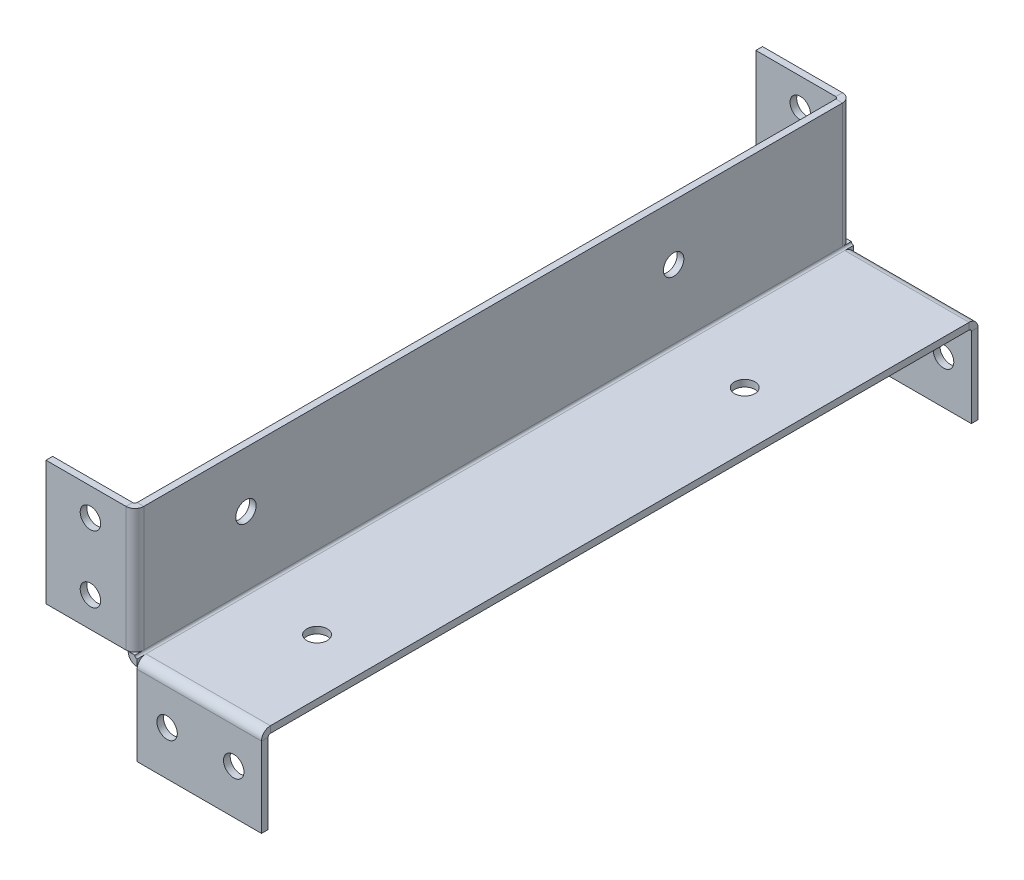
from build123d import *

# Parameters (mm, degrees)
SKETCH1_W                      = 60
SKETCH1_H                      = 322.5
BASE_FLANGE1_DEPTH             = 3
EDGE_FLANGE1_STRIP_W           = 14
EDGE_FLANGE1_STRIP_H           = 3
EDGE_FLANGE1_STRIP_CUT_DEPTH   = 322.5
EDGE_FLANGE1_DEPTH             = 322.5
EDGE_FLANGE2_STRIP_W           = 14
EDGE_FLANGE2_STRIP_H           = 3
EDGE_FLANGE2_STRIP_CUT_DEPTH   = 56
EDGE_FLANGE2_STRIP_2_W         = 14
EDGE_FLANGE2_STRIP_2_H         = 3
EDGE_FLANGE2_STRIP_CUT_2_DEPTH = 56
EDGE_FLANGE2_STRIP_3_W         = 14
EDGE_FLANGE2_STRIP_3_H         = 3
EDGE_FLANGE2_STRIP_CUT_3_DEPTH = 56
EDGE_FLANGE2_STRIP_4_W         = 14
EDGE_FLANGE2_STRIP_4_H         = 3
EDGE_FLANGE2_STRIP_CUT_4_DEPTH = 56
EDGE_FLANGE2_DEPTH             = 56
EDGE_FLANGE2_BEND_DEPTH        = 56
EDGE_FLANGE2_BEND_2_DEPTH      = 56
EDGE_FLANGE2_BEND_3_DEPTH      = 56
SKETCH18_R                     = 4.6
EXTRUDE1_DEPTH                 = 335.806287277
SKETCH19_R                     = 4.6
EXTRUDE2_DEPTH                 = 3
SKETCH20_R                     = 4.6
EXTRUDE3_DEPTH                 = 3


# Sheet-metal steps are written as plain solids
with BuildPart() as part:
    # Sketch1 → Base-Flange1 (new body)
    with BuildSketch(Plane(origin=(0, 0, 0), x_dir=(1, 0, 0), z_dir=(0, 1, 0))):
        Rectangle(SKETCH1_W, SKETCH1_H)
    extrude(amount=BASE_FLANGE1_DEPTH)

    # Edge-Flange1 strip (across the edge) → Edge-Flange1 strip cut (cut)
    with BuildSketch(Plane(origin=(-30, 3, -161.25), x_dir=(1, 0, 0), z_dir=(0, 0, 1))):
        with Locations((-3, -1.5)):
            Rectangle(EDGE_FLANGE1_STRIP_W, EDGE_FLANGE1_STRIP_H)
    extrude(amount=EDGE_FLANGE1_STRIP_CUT_DEPTH, mode=Mode.SUBTRACT)

    # Edge-Flange1 section (across the edge) → Edge-Flange1 (add)
    with BuildSketch(Plane(origin=(-30, 3, -161.25), x_dir=(1, 0, 0), z_dir=(0, 0, 1))):
        with BuildLine():
            Line((0, 1), (0, 57))
            Line((0, 57), (3, 57))
            Line((3, 57), (3, 1))
            ThreePointArc((3, 1), (3.292893219, 0.292893219), (4, 0))
            Line((4, 0), (4, -3))
            ThreePointArc((4, -3), (1.171572875, -1.828427125), (0, 1))
        make_face()
    extrude(amount=EDGE_FLANGE1_DEPTH)

    # Edge-Flange2 strip (across the edge) → Edge-Flange2 strip cut (cut)
    with BuildSketch(Plane(origin=(-30, 4, 161.25), x_dir=(0, 0, -1), z_dir=(0, 1, 0))):
        with Locations((-3, -1.5)):
            Rectangle(EDGE_FLANGE2_STRIP_W, EDGE_FLANGE2_STRIP_H)
    extrude(amount=EDGE_FLANGE2_STRIP_CUT_DEPTH, mode=Mode.SUBTRACT)

    # Edge-Flange2 strip 2 (across the edge) → Edge-Flange2 strip cut 2 (cut)
    with BuildSketch(Plane(origin=(30, 0, 161.25), x_dir=(0, 0, -1), z_dir=(-1, 0, 0))):
        with Locations((-3, -1.5)):
            Rectangle(EDGE_FLANGE2_STRIP_2_W, EDGE_FLANGE2_STRIP_2_H)
    extrude(amount=EDGE_FLANGE2_STRIP_CUT_2_DEPTH, mode=Mode.SUBTRACT)

    # Edge-Flange2 strip 3 (across the edge) → Edge-Flange2 strip cut 3 (cut)
    with BuildSketch(Plane(origin=(-30, 60, -161.25), x_dir=(0, 0, 1), z_dir=(0, -1, 0))):
        with Locations((-3, -1.5)):
            Rectangle(EDGE_FLANGE2_STRIP_3_W, EDGE_FLANGE2_STRIP_3_H)
    extrude(amount=EDGE_FLANGE2_STRIP_CUT_3_DEPTH, mode=Mode.SUBTRACT)

    # Edge-Flange2 strip 4 (across the edge) → Edge-Flange2 strip cut 4 (cut)
    with BuildSketch(Plane(origin=(-26, 0, -161.25), x_dir=(0, 0, 1), z_dir=(1, 0, 0))):
        with Locations((-3, -1.5)):
            Rectangle(EDGE_FLANGE2_STRIP_4_W, EDGE_FLANGE2_STRIP_4_H)
    extrude(amount=EDGE_FLANGE2_STRIP_CUT_4_DEPTH, mode=Mode.SUBTRACT)

    # Edge-Flange2 section (across the edge) → Edge-Flange2 (add)
    with BuildSketch(Plane(origin=(-30, 4, 161.25), x_dir=(0, 0, -1), z_dir=(0, 1, 0))):
        with BuildLine():
            Line((0, 1), (0, 37))
            Line((0, 37), (3, 37))
            Line((3, 37), (3, 1))
            ThreePointArc((3, 1), (3.292893219, 0.292893219), (4, 0))
            Line((4, 0), (4, -3))
            ThreePointArc((4, -3), (1.171572875, -1.828427125), (0, 1))
        make_face()
    extrude(amount=EDGE_FLANGE2_DEPTH)

    # Edge-Flange2 section 2 (across the edge) → Edge-Flange2 bend (add)
    with BuildSketch(Plane(origin=(30, 0, 161.25), x_dir=(0, 0, -1), z_dir=(-1, 0, 0))):
        with BuildLine():
            Line((0, 1), (0, 37))
            Line((0, 37), (3, 37))
            Line((3, 37), (3, 1))
            ThreePointArc((3, 1), (3.292893219, 0.292893219), (4, 0))
            Line((4, 0), (4, -3))
            ThreePointArc((4, -3), (1.171572875, -1.828427125), (0, 1))
        make_face()
    extrude(amount=EDGE_FLANGE2_BEND_DEPTH)

    # Edge-Flange2 section 3 (across the edge) → Edge-Flange2 bend 2 (add)
    with BuildSketch(Plane(origin=(-30, 60, -161.25), x_dir=(0, 0, 1), z_dir=(0, -1, 0))):
        with BuildLine():
            Line((0, 1), (0, 37))
            Line((0, 37), (3, 37))
            Line((3, 37), (3, 1))
            ThreePointArc((3, 1), (3.292893219, 0.292893219), (4, 0))
            Line((4, 0), (4, -3))
            ThreePointArc((4, -3), (1.171572875, -1.828427125), (0, 1))
        make_face()
    extrude(amount=EDGE_FLANGE2_BEND_2_DEPTH)

    # Edge-Flange2 section 4 (across the edge) → Edge-Flange2 bend 3 (add)
    with BuildSketch(Plane(origin=(-26, 0, -161.25), x_dir=(0, 0, 1), z_dir=(1, 0, 0))):
        with BuildLine():
            Line((0, 1), (0, 37))
            Line((0, 37), (3, 37))
            Line((3, 37), (3, 1))
            ThreePointArc((3, 1), (3.292893219, 0.292893219), (4, 0))
            Line((4, 0), (4, -3))
            ThreePointArc((4, -3), (1.171572875, -1.828427125), (0, 1))
        make_face()
    extrude(amount=EDGE_FLANGE2_BEND_3_DEPTH)

    # Sketch18 → Extrude1 (cut, through all)
    with BuildSketch(Plane.XY.offset(161.25)):
        with Locations((-47, 47.5)):
            Circle(SKETCH18_R)
        with Locations((-47, 17.5)):
            Circle(SKETCH18_R)
        with Locations((-12.5, -17)):
            Circle(SKETCH18_R)
        with Locations((17.5, -17)):
            Circle(SKETCH18_R)
    extrude(amount=-EXTRUDE1_DEPTH, mode=Mode.SUBTRACT)

    # Sketch19 → Extrude2 (cut)
    with BuildSketch(Plane(origin=(-27, 0, 0), x_dir=(0, 0, -1), z_dir=(1, 0, 0))):
        with Locations(Location((-111.25, 35, 0), (0, 0, 90))):
            Circle(SKETCH19_R)
        with Locations(Location((81.25, 35, 0), (0, 0, 90))):
            Circle(SKETCH19_R)
    extrude(amount=-EXTRUDE2_DEPTH, mode=Mode.SUBTRACT)

    # Sketch20 → Extrude3 (cut)
    with BuildSketch(Plane(origin=(0, 3, 0), x_dir=(1, 0, 0), z_dir=(0, 1, 0))):
        with Locations(Location((5, 81.25, 0), (0, 0, 270))):
            Circle(SKETCH20_R)
        with Locations(Location((5, -111.25, 0), (0, 0, 270))):
            Circle(SKETCH20_R)
    extrude(amount=-EXTRUDE3_DEPTH, mode=Mode.SUBTRACT)


solid = part.part
